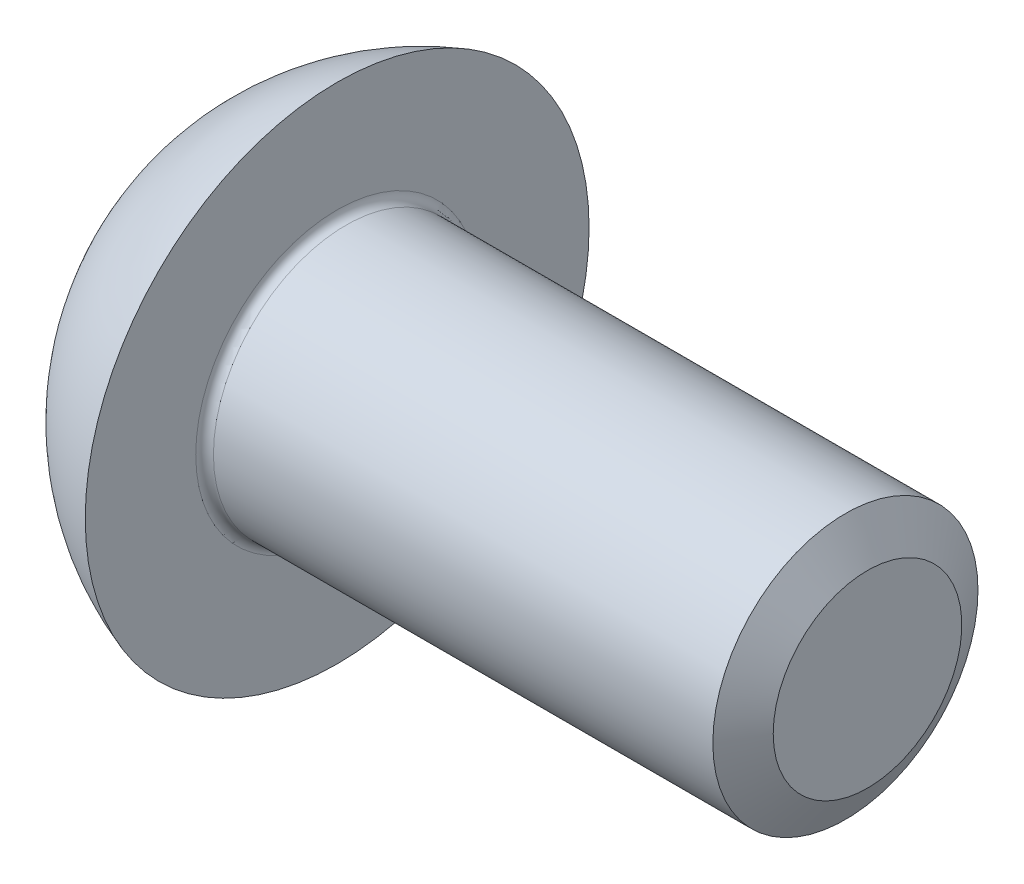
from build123d import *

# Parameters (mm, degrees)
CUT_EXTRUDE_1_DEPTH = 1.65


with BuildPart() as part:
    # 草图1 → 旋转1 (revolve)
    with BuildSketch(Plane.XY):
        with BuildLine():
            Line((0, 1.5), (-5.9, 1.5))
            ThreePointArc((-5.9, 1.5), (-5.970710678, 1.529289322), (-6, 1.6))
            Line((-6, 1.6), (-6, 2.85))
            ThreePointArc((-6, 2.85), (-6.948716751, 2.326209363), (-7.65, 1.5))
            Line((-7.65, 1.5), (-7.65, 0))
            Line((-7.65, 0), (0, 0))
            Line((0, 0), (0, 1.5))
        make_face()
    revolve(axis=Axis((-7.65, 0, 0), (1, 0, 0)))

    # 草图2 → 切除-拉伸1 (cut)
    with BuildSketch(Plane.ZY.offset(7.65)):
        Polygon((0, 1.154700538), (-1, 0.577350269), (-1, -0.577350269), (0, -1.154700538), (1, -0.577350269), (1, 0.577350269), align=None)
    extrude(amount=-CUT_EXTRUDE_1_DEPTH, mode=Mode.SUBTRACT)

    # 草图6 → 旋转2 (revolve)
    with BuildSketch(Plane.XY):
        Polygon((-6.61, 1.154700538), (-6, 0), (-5.7, 0), (-5.7, 1.154700538), align=None)
    revolve(axis=Axis((-7.65, 0, 0), (1, 0, 0)))

    # 草图7 → 切除-旋转5 (revolve, cut)
    with BuildSketch(Plane.XY):
        Polygon((-7.65, 1.154700538), (-7.35, 0), (-7.65, 0), align=None)
    revolve(axis=Axis((-7.65, 0, 0), (1, 0, 0)), mode=Mode.SUBTRACT)

    # 草图4 → 切除-旋转1 (revolve, cut)
    with BuildSketch(Plane.XY):
        Polygon((-0.25, 1.5), (0, 1.066987298), (0.25, 1.5), align=None)
    revolve(axis=Axis((-0.25, 0, 0), (1, 0, 0)), mode=Mode.SUBTRACT)


solid = part.part
